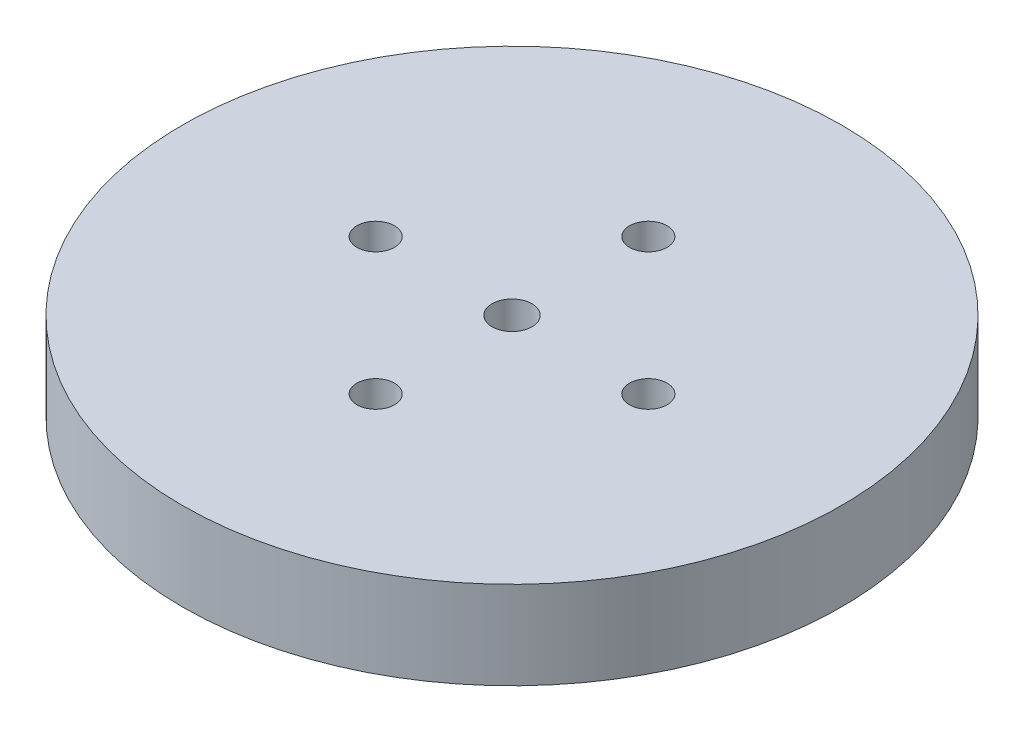
from build123d import *

# Parameters (mm, degrees)
SKETCH1_R           = 82.5
BOSS_EXTRUDE1_DEPTH = 22
SKETCH2_R           = 5
CUT_EXTRUDE1_DEPTH  = 119.728682297
SKETCH3_R           = 4.704637838
CUT_EXTRUDE2_DEPTH  = 20.824960151
CIRPATTERN1_COUNT   = 4


with BuildPart() as part:
    # Sketch1 → Boss-Extrude1 (new body)
    with BuildSketch(Plane(origin=(0, 0, 0), x_dir=(1, 0, 0), z_dir=(0, 1, 0))):
        Circle(SKETCH1_R)
    extrude(amount=BOSS_EXTRUDE1_DEPTH)

    # Sketch2 → Cut-Extrude1 (cut, through all)
    with BuildSketch(Plane(origin=(0, 0, 0), x_dir=(1, 0, 0), z_dir=(0, 1, 0))):
        Circle(SKETCH2_R)
    extrude(amount=CUT_EXTRUDE1_DEPTH, mode=Mode.SUBTRACT)

    # Sketch3 → Cut-Extrude2 (cut)
    with BuildSketch(Plane(origin=(0, 22, 0), x_dir=(1, 0, 0), z_dir=(0, 1, 0))):
        with Locations((-34.124861408, 0)):
            Circle(SKETCH3_R)
    cut_extrude2 = extrude(amount=-CUT_EXTRUDE2_DEPTH, mode=Mode.SUBTRACT)

    # CirPattern1: Cut-Extrude2 ×4 about axis
    cirpattern1_axis = Axis((0, 0, 0), (0, 1, 0))
    for i in range(1, CIRPATTERN1_COUNT):
        add(cut_extrude2.rotate(cirpattern1_axis, i * 360 / CIRPATTERN1_COUNT), mode=Mode.SUBTRACT)


solid = part.part
